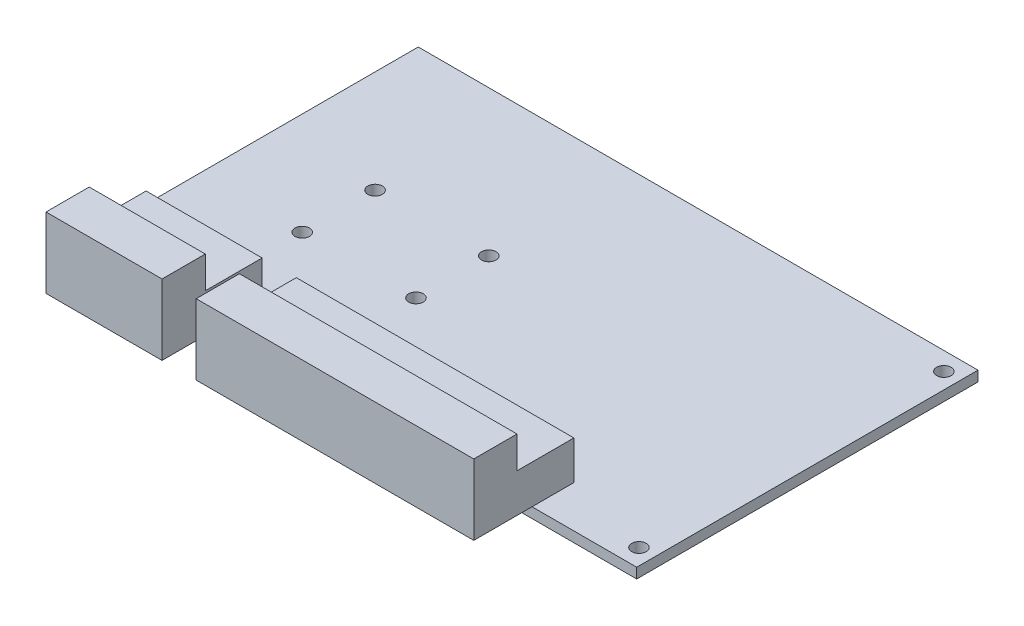
from build123d import *

# Parameters (mm, degrees)
SKETCH1_W           = 123
SKETCH1_H           = 75
SKETCH1_R           = 1.6
BOSS_EXTRUDE1_DEPTH = 2.25
SKETCH2_W           = 25.5
SKETCH2_H           = 22
SKETCH2_W_2         = 61
BOSS_EXTRUDE2_DEPTH = 8.5
SKETCH3_W           = 25.5
SKETCH3_H           = 9.5
SKETCH3_W_2         = 61
BOSS_EXTRUDE3_DEPTH = 7


with BuildPart() as part:
    # Sketch1 → Boss-Extrude1 (new body)
    with BuildSketch(Plane(origin=(0, 0, 0), x_dir=(1, 0, 0), z_dir=(0, 1, 0))):
        with Locations((61.5, 37.5)):
            Rectangle(SKETCH1_W, SKETCH1_H)
        with Locations((119.5, 71)):
            Circle(SKETCH1_R, mode=Mode.SUBTRACT)
        with Locations((119.5, 4)):
            Circle(SKETCH1_R, mode=Mode.SUBTRACT)
        with Locations((3.5, 4)):
            Circle(SKETCH1_R, mode=Mode.SUBTRACT)
        with Locations((22.5, 43)):
            Circle(SKETCH1_R, mode=Mode.SUBTRACT)
        with Locations((47.5, 43)):
            Circle(SKETCH1_R, mode=Mode.SUBTRACT)
        with Locations((22.5, 27)):
            Circle(SKETCH1_R, mode=Mode.SUBTRACT)
        with Locations((47.5, 27)):
            Circle(SKETCH1_R, mode=Mode.SUBTRACT)
    extrude(amount=BOSS_EXTRUDE1_DEPTH)

    # Sketch2 → Boss-Extrude2 (add)
    with BuildSketch(Plane(origin=(0, 2.25, 0), x_dir=(1, 0, 0), z_dir=(0, 1, 0))):
        with Locations((18.75, -1.8)):
            Rectangle(SKETCH2_W, SKETCH2_H)
        with Locations((69.5, -1.8)):
            Rectangle(SKETCH2_W_2, SKETCH2_H)
    extrude(amount=BOSS_EXTRUDE2_DEPTH)

    # Sketch3 → Boss-Extrude3 (add)
    with BuildSketch(Plane(origin=(0, 10.75, 0), x_dir=(1, 0, 0), z_dir=(0, 1, 0))):
        with Locations((18.75, -8.05)):
            Rectangle(SKETCH3_W, SKETCH3_H)
        with Locations((69.5, -8.05)):
            Rectangle(SKETCH3_W_2, SKETCH3_H)
    extrude(amount=BOSS_EXTRUDE3_DEPTH)


solid = part.part
